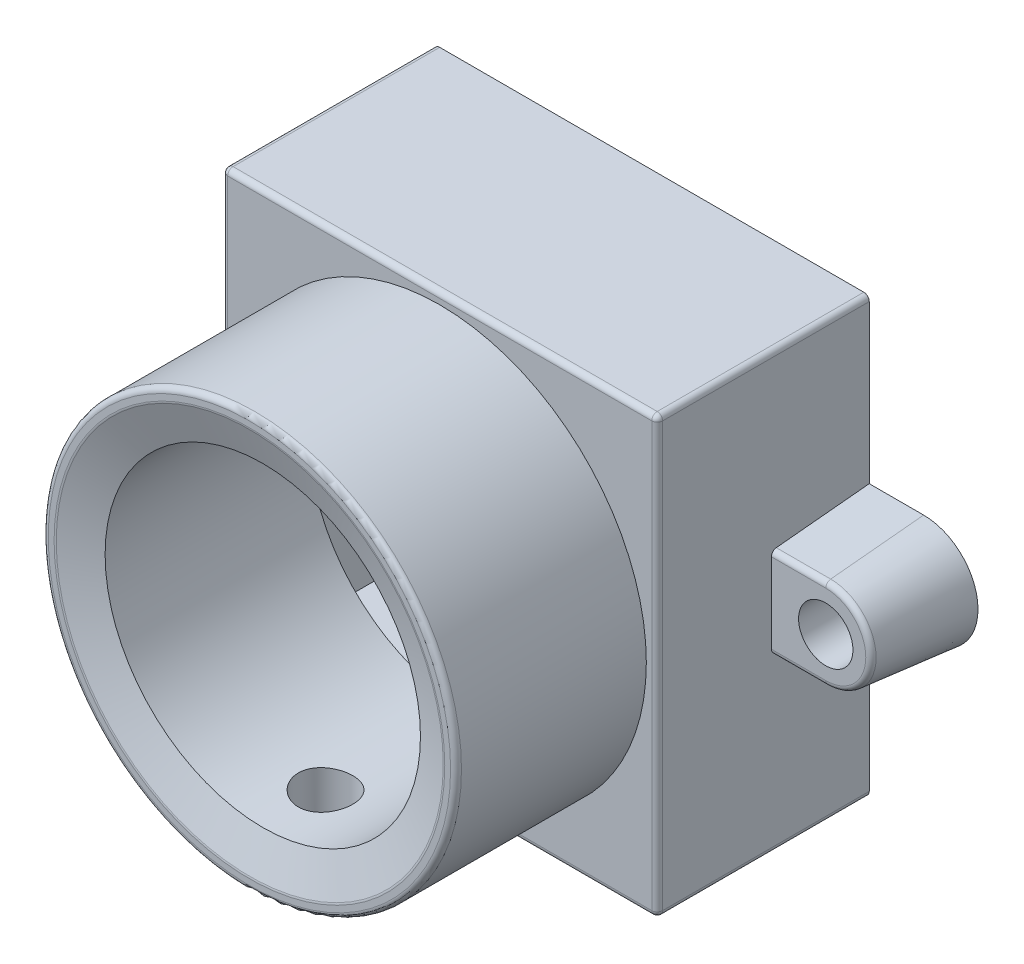
from build123d import *

# Parameters (mm, degrees)
SKETCH_1_W             = 16
SKETCH_1_H             = 16
EXTRUDE_1_DEPTH        = 7.8
SKETCH_2_R             = 7.6
EXTRUDE_2_DEPTH        = 7
EXTRUDE_3_DEPTH        = 3.6
EXTRUDE_3_TAPER        = 5.5
SKETCH_4_R             = 1
CUT_EXTRUDE_1_DEPTH    = 19.260339646
FILLET_1_R             = 0.2
FILLET_1_OF_MIRROR_1_R = 0.2
SKETCH_5_W             = 14.2
SKETCH_5_H             = 14.2
CUT_EXTRUDE_2_DEPTH    = 6.8
SKETCH_6_R             = 5.8
CUT_EXTRUDE_3_DEPTH    = 17.492422624
CHAMFER_1_SIZE         = 1.35
CHAMFER_1_SIZE2        = 0.491359816
FILLET_2_R             = 0.2
SKETCH_7_R             = 1
CUT_EXTRUDE_4_DEPTH    = 21.664946262
FILLET_3_R             = 0.2


with BuildPart() as part:
    # 草图1 → 凸台-拉伸1 (new body)
    with BuildSketch(Plane.XY):
        Rectangle(SKETCH_1_W, SKETCH_1_H)
    extrude(amount=EXTRUDE_1_DEPTH)

    # 草图2 → 凸台-拉伸2 (add)
    with BuildSketch(Plane.XY.offset(7.8)):
        Circle(SKETCH_2_R)
    extrude(amount=EXTRUDE_2_DEPTH)

    # 草图3 → 凸台-拉伸3 (add)
    with BuildSketch(Plane(origin=(0, 0, 0), x_dir=(-1, 0, 0), z_dir=(0, 0, -1))):
        with BuildLine():
            Line((10, 2), (4, 2))
            Line((4, 2), (4, -2))
            Line((4, -2), (10, -2))
            ThreePointArc((10, -2), (12, 0), (10, 2))
        make_face()
    extrude_3 = extrude(amount=-EXTRUDE_3_DEPTH, taper=EXTRUDE_3_TAPER)

    # 草图4 → 切除-拉伸1 (cut, through all)
    with BuildSketch(Plane.XY.offset(3.6)):
        with Locations((-10, 0)):
            Circle(SKETCH_4_R)
    cut_extrude_1 = extrude(amount=-CUT_EXTRUDE_1_DEPTH, mode=Mode.SUBTRACT)

    # 圆角1
    fillet_1_edges = [part.edges().sort_by_distance(p)[0] for p in [
        (-9, 1.653359426, 3.6),
        (-11.653359426, 0, 3.6),
        (-9, -1.653359426, 3.6),
    ]]
    fillet(fillet_1_edges, radius=FILLET_1_R)

    # 镜向1: 凸台-拉伸3, 切除-拉伸1 across plane
    add(extrude_3.mirror(Plane(origin=(0, 0, 0), x_dir=(0, 0, 1), z_dir=(1, 0, 0))))
    add(cut_extrude_1.mirror(Plane(origin=(0, 0, 0), x_dir=(0, 0, 1), z_dir=(1, 0, 0))), mode=Mode.SUBTRACT)

    # 圆角1 of 镜向1
    fillet_1_of_mirror_1_edges = [part.edges().sort_by_distance(p)[0] for p in [
        (9, 1.653359426, 3.6),
        (11.653359426, 0, 3.6),
        (9, -1.653359426, 3.6),
    ]]
    fillet(fillet_1_of_mirror_1_edges, radius=FILLET_1_OF_MIRROR_1_R)

    # 草图5 → 切除-拉伸2 (cut)
    with BuildSketch(Plane(origin=(0, 0, 0), x_dir=(-1, 0, 0), z_dir=(0, 0, -1))):
        Rectangle(SKETCH_5_W, SKETCH_5_H)
    extrude(amount=-CUT_EXTRUDE_2_DEPTH, mode=Mode.SUBTRACT)

    # 草图6 → 切除-拉伸3 (cut, through all)
    with BuildSketch(Plane(origin=(0, 0, 6.8), x_dir=(-1, 0, 0), z_dir=(0, 0, -1))):
        Circle(SKETCH_6_R)
    extrude(amount=-CUT_EXTRUDE_3_DEPTH, mode=Mode.SUBTRACT)

    # 倒角1
    chamfer_1_edges = [part.edges().sort_by_distance(p)[0] for p in [
        (5.8, 0, 14.8),
    ]]
    chamfer_1_side = [part.faces().sort_by_distance(p)[0] for p in [
        (-7.385039539, 0, 14.8),
    ]]
    chamfer(chamfer_1_edges, length=CHAMFER_1_SIZE, length2=CHAMFER_1_SIZE2, reference=chamfer_1_side[0])

    # 圆角2
    fillet_2_edges = [part.edges().sort_by_distance(p)[0] for p in [
        (-7.6, 0, 14.8),
        (7.15, 0, 14.8),
    ]]
    fillet(fillet_2_edges, radius=FILLET_2_R)

    # 草图7 → 切除-拉伸4 (cut, through all)
    with BuildSketch(Plane(origin=(0, 0, 0), x_dir=(1, 0, 0), z_dir=(0, 1, 0))):
        with Locations((0, -12)):
            Circle(SKETCH_7_R)
    extrude(amount=-CUT_EXTRUDE_4_DEPTH, mode=Mode.SUBTRACT)

    # 圆角3
    fillet_3_edges = [part.edges().sort_by_distance(p)[0] for p in [
        (-8, 0, 7.8),
        (0, 8, 7.8),
        (8, 0, 7.8),
        (0, -8, 7.8),
        (-8, 8, 3.9),
        (8, 8, 3.9),
        (8, -8, 3.9),
        (-8, -8, 3.9),
    ]]
    fillet(fillet_3_edges, radius=FILLET_3_R)


solid = part.part
